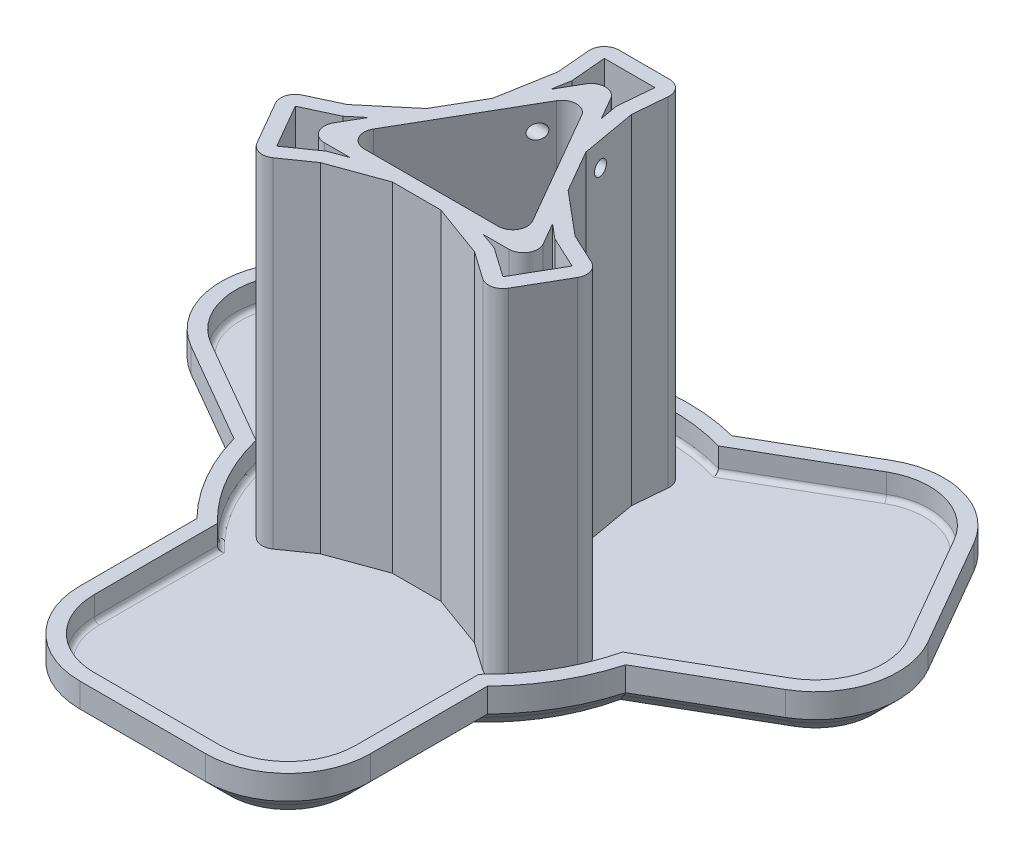
from build123d import *

# Parameters (mm, degrees)
SKETCH_1_R               = 40
EXTRUDE_1_DEPTH          = 5
EXTRUDE_2_DEPTH          = 70
FILLET_1_R               = 15
FILLET_2_R               = 3
SKETCH_6_R               = 3.5
SKETCH_6_R_2             = 1.5
CUT_EXTRUDE_1_DEPTH      = 5
FILLET_3_R               = 3
CUT_EXTRUDE_2_DEPTH      = 10
CUT_EXTRUDE_2_DEPTH_BACK = 10
SKETCH_7_R               = 1.5
CHAMFER_1_SIZE           = 2
EXTRUDE_3_DEPTH          = 5
CHAMFER_2_SIZE           = 2
CHAMFER_3_SIZE           = 3
FILLET_4_R               = 1


with BuildPart() as part:
    # 草图1 → 凸台-拉伸1 (new body)
    with BuildSketch(Plane(origin=(0, 0, 0), x_dir=(1, 0, 0), z_dir=(0, 1, 0))):
        Circle(SKETCH_1_R)
        with BuildLine():
            Line((-73.379649905, 10.034145551), (-38.738633754, -9.965854449))
            ThreePointArc((-38.738633754, -9.965854449), (-34.641016151, 20), (-10.738633754, 38.531568163))
            Line((-10.738633754, 38.531568163), (-45.379649905, 58.531568163))
            Line((-45.379649905, 58.531568163), (-73.379649905, 10.034145551))
        make_face()
        with BuildLine():
            ThreePointArc((40, 0), (39.683405538, -5.02268105), (38.738633754, -9.965854449))
            Line((38.738633754, -9.965854449), (73.379649905, 10.034145551))
            Line((73.379649905, 10.034145551), (45.379649905, 58.531568163))
            Line((45.379649905, 58.531568163), (10.738633754, 38.531568163))
            ThreePointArc((10.738633754, 38.531568163), (31.85549678, 24.191472153), (40, 0))
        make_face()
        with BuildLine():
            ThreePointArc((28, -28.565713714), (0, -40), (-28, -28.565713714))
            Line((-28, -28.565713714), (-28, -68.565713714))
            Line((-28, -68.565713714), (28, -68.565713714))
            Line((28, -68.565713714), (28, -28.565713714))
        make_face()
    extrude(amount=EXTRUDE_1_DEPTH)

    # 草图3 → 凸台-拉伸2 (add)
    with BuildSketch(Plane(origin=(0, 5, 0), x_dir=(1, 0, 0), z_dir=(0, 1, 0))):
        Polygon((5, -14), (13.7714132, -14), (5.528980942, -11), (-5.528980942, -11), (-13.7714132, -14), (-5, -14), align=None)
        Polygon((23.529502777, -4.802432686), (14.624355653, 2.669872981), (19.010062253, -4.926393678), (21.90369494, -7.354439798), (28.593799362, -10.474086724), (23.367724865, -19.525913276), (17.320979166, -15.291936356), (13.7714132, -14), (5, -14), (15.923780094, -17.9759308), (24.328838325, -23.861215932), (32.828838325, -9.138784068), align=None)
        Polygon((-19.010062253, -4.926393678), (-14.624355653, 2.669872981), (-23.529502777, -4.802432686), (-32.828838325, -9.138784068), (-24.328838325, -23.861215932), (-15.923780094, -17.9759308), (-5, -14), (-13.7714132, -14), (-17.320979166, -15.291936356), (-23.367724865, -19.525913276), (-28.593799362, -10.474086724), (-21.90369494, -7.354439798), align=None)
        Polygon((-6.761788971, 10.288237953), (-5.238649053, 18.926393678), (-9.624355653, 11.330127019), (-14.624355653, 2.669872981), (-19.010062253, -4.926393678), (-12.290769913, 0.711762047), align=None)
        Polygon((5.238649053, 18.926393678), (9.624355653, 11.330127019), (7.605722682, 22.778363486), (8.5, 33), (-8.5, 33), (-7.605722682, 22.778363486), (-9.624355653, 11.330127019), (-5.238649053, 18.926393678), (-4.582715774, 22.646376154), (-5.226074497, 30), (5.226074497, 30), (4.582715774, 22.646376154), align=None)
        Polygon((14.624355653, 2.669872981), (9.624355653, 11.330127019), (5.238649053, 18.926393678), (6.761788971, 10.288237953), (12.290769913, 0.711762047), (19.010062253, -4.926393678), align=None)
        Polygon((24.248711306, -14), (19.010062253, -4.926393678), (12.290769913, 0.711762047), (19.052558883, -11), (5.528980942, -11), (13.7714132, -14), align=None)
        Polygon((-19.052558883, -11), (-12.290769913, 0.711762047), (-19.010062253, -4.926393678), (-24.248711306, -14), (-13.7714132, -14), (-5.528980942, -11), align=None)
        Polygon((6.761788971, 10.288237953), (5.238649053, 18.926393678), (0, 28), (-5.238649053, 18.926393678), (-6.761788971, 10.288237953), (0, 22), align=None)
    extrude(amount=EXTRUDE_2_DEPTH)

    # 圆角1
    fillet_1_edges = [part.edges().sort_by_distance(p)[0] for p in [
        (28, 2.5, 68.565713714),
        (-28, 2.5, 68.565713714),
        (-73.379649905, 2.5, -10.034145551),
        (-45.379649905, 2.5, -58.531568163),
        (45.379649905, 2.5, -58.531568163),
        (73.379649905, 2.5, -10.034145551),
    ]]
    fillet(fillet_1_edges, radius=FILLET_1_R)

    # 圆角2
    fillet_2_edges = [part.edges().sort_by_distance(p)[0] for p in [
        (24.248711306, 40, 14),
        (-24.248711306, 40, 14),
        (-19.052558883, 40, 11),
        (0, 40, -22),
        (0, 40, -28),
        (19.052558883, 40, 11),
    ]]
    fillet(fillet_2_edges, radius=FILLET_2_R)

    # 草图6 → 切除-拉伸1 (cut)
    with BuildSketch(Plane.XZ):
        with Locations(Location((0, 0, 0), (0, 0, 270))):
            Circle(SKETCH_6_R)
        with Locations(Location((0, 7, 0), (0, 0, 270))):
            Circle(SKETCH_6_R_2)
        with Locations(Location((7, 0, 0), (0, 0, 270))):
            Circle(SKETCH_6_R_2)
        with Locations(Location((-7, 0, 0), (0, 0, 90))):
            Circle(SKETCH_6_R_2)
        with Locations(Location((0, -7, 0), (0, 0, 90))):
            Circle(SKETCH_6_R_2)
    extrude(amount=-CUT_EXTRUDE_1_DEPTH, mode=Mode.SUBTRACT)

    # 圆角3
    fillet_3_edges = [part.edges().sort_by_distance(p)[0] for p in [
        (-32.828838325, 40, 9.138784068),
        (-24.328838325, 40, 23.861215932),
        (24.328838325, 40, 23.861215932),
        (32.828838325, 40, 9.138784068),
        (8.5, 40, -33),
        (-8.5, 40, -33),
    ]]
    fillet(fillet_3_edges, radius=FILLET_3_R)

    # 草图7 → 切除-拉伸2 (cut, two sides: drawn at the far end of the back side and taken through both)
    with BuildSketch(Plane(origin=(0, 0, 0), x_dir=(0, 0, -1), z_dir=(1, 0, 0)).offset(-CUT_EXTRUDE_2_DEPTH_BACK)):
        with Locations((15, 70)):
            Circle(SKETCH_7_R)
    extrude(amount=CUT_EXTRUDE_2_DEPTH + CUT_EXTRUDE_2_DEPTH_BACK, mode=Mode.SUBTRACT)

    # 倒角1
    chamfer_1_edges = [part.edges().sort_by_distance(p)[0] for p in [
        (9.526279442, 5, -5.5),
        (-9.526279442, 5, -5.5),
        (0, 5, 11),
        (-16.454482672, 5, 9.5),
        (16.454482672, 5, 9.5),
        (0, 5, -19),
    ]]
    chamfer(chamfer_1_edges, length=CHAMFER_1_SIZE)

    # 草图8 → 凸台-拉伸3 (add)
    # profile 1 of 2: a face of its own
    with BuildSketch(Plane(origin=(0, 5, 0), x_dir=(1, 0, 0), z_dir=(0, 1, 0))):
        with BuildLine():
            Line((-54.611700713, 46.541187106), (-67.611700713, 24.024526608))
            ThreePointArc((-67.611700713, 24.024526608), (-69.310007895, 11.124602841), (-61.389268848, 0.802094744))
            Line((-61.389268848, 0.802094744), (-40.455844123, -11.283823657))
            ThreePointArc((-40.455844123, -11.283823657), (-36.373066959, -21), (-30, -29.393876913))
            Line((-30, -29.393876913), (-30, -53.565713714))
            ThreePointArc((-30, -53.565713714), (-25.02081528, -65.586528994), (-13, -70.565713714))
            Line((-13, -70.565713714), (13, -70.565713714))
            ThreePointArc((13, -70.565713714), (25.02081528, -65.586528994), (30, -53.565713714))
            Line((30, -53.565713714), (30, -29.393876913))
            ThreePointArc((30, -29.393876913), (36.373066959, -21), (40.455844123, -11.283823657))
            Line((40.455844123, -11.283823657), (61.389268848, 0.802094744))
            ThreePointArc((61.389268848, 0.802094744), (69.310007895, 11.124602841), (67.611700713, 24.024526608))
            Line((67.611700713, 24.024526608), (54.611700713, 46.541187106))
            ThreePointArc((54.611700713, 46.541187106), (44.289192615, 54.461926153), (31.389268848, 52.763618971))
            Line((31.389268848, 52.763618971), (10.455844123, 40.67770057))
            ThreePointArc((10.455844123, 40.67770057), (0, 42), (-10.455844123, 40.67770057))
            Line((-10.455844123, 40.67770057), (-31.389268848, 52.763618971))
            ThreePointArc((-31.389268848, 52.763618971), (-44.289192615, 54.461926153), (-54.611700713, 46.541187106))
        make_face()
        with BuildLine():
            Line((-13, -68.565713714), (13, -68.565713714))
            ThreePointArc((13, -68.565713714), (23.606601718, -64.172315432), (28, -53.565713714))
            Line((28, -53.565713714), (28, -28.565713714))
            ThreePointArc((28, -28.565713714), (34.641016151, -20), (38.738633754, -9.965854449))
            Line((38.738633754, -9.965854449), (60.389268848, 2.534145551))
            ThreePointArc((60.389268848, 2.534145551), (67.378156243, 11.642240931), (65.879649905, 23.024526608))
            Line((65.879649905, 23.024526608), (52.879649905, 45.541187106))
            ThreePointArc((52.879649905, 45.541187106), (43.771554525, 52.530074501), (32.389268848, 51.031568163))
            Line((32.389268848, 51.031568163), (10.738633754, 38.531568163))
            ThreePointArc((10.738633754, 38.531568163), (0, 40), (-10.738633754, 38.531568163))
            Line((-10.738633754, 38.531568163), (-32.389268848, 51.031568163))
            ThreePointArc((-32.389268848, 51.031568163), (-43.771554525, 52.530074501), (-52.879649905, 45.541187106))
            Line((-52.879649905, 45.541187106), (-65.879649905, 23.024526608))
            ThreePointArc((-65.879649905, 23.024526608), (-67.378156243, 11.642240931), (-60.389268848, 2.534145551))
            Line((-60.389268848, 2.534145551), (-38.738633754, -9.965854449))
            ThreePointArc((-38.738633754, -9.965854449), (-34.641016151, -20), (-28, -28.565713714))
            Line((-28, -28.565713714), (-28, -53.565713714))
            ThreePointArc((-28, -53.565713714), (-23.606601718, -64.172315432), (-13, -68.565713714))
        make_face(mode=Mode.SUBTRACT)
    # profile 2 of 2: a face of its own
    with BuildSketch(Plane(origin=(0, 5, 0), x_dir=(1, 0, 0), z_dir=(0, 1, 0))):
        with BuildLine():
            ThreePointArc((-28, -53.565713714), (-23.606601718, -64.172315432), (-13, -68.565713714))
            Line((-13, -68.565713714), (13, -68.565713714))
            ThreePointArc((13, -68.565713714), (23.606601718, -64.172315432), (28, -53.565713714))
            Line((28, -53.565713714), (28, -28.565713714))
            ThreePointArc((28, -28.565713714), (34.641016151, -20), (38.738633754, -9.965854449))
            Line((38.738633754, -9.965854449), (60.389268848, 2.534145551))
            ThreePointArc((60.389268848, 2.534145551), (67.378156243, 11.642240931), (65.879649905, 23.024526608))
            Line((65.879649905, 23.024526608), (52.879649905, 45.541187106))
            ThreePointArc((52.879649905, 45.541187106), (43.771554525, 52.530074501), (32.389268848, 51.031568163))
            Line((32.389268848, 51.031568163), (10.738633754, 38.531568163))
            ThreePointArc((10.738633754, 38.531568163), (0, 40), (-10.738633754, 38.531568163))
            Line((-10.738633754, 38.531568163), (-32.389268848, 51.031568163))
            ThreePointArc((-32.389268848, 51.031568163), (-43.771554525, 52.530074501), (-52.879649905, 45.541187106))
            Line((-52.879649905, 45.541187106), (-65.879649905, 23.024526608))
            ThreePointArc((-65.879649905, 23.024526608), (-67.378156243, 11.642240931), (-60.389268848, 2.534145551))
            Line((-60.389268848, 2.534145551), (-38.738633754, -9.965854449))
            ThreePointArc((-38.738633754, -9.965854449), (-34.641016151, -20), (-28, -28.565713714))
            Line((-28, -28.565713714), (-28, -53.565713714))
        make_face()
        with BuildLine():
            ThreePointArc((-37.872115214, -9.311438623), (-33.774990748, -19.5), (-27, -28.142494559))
            Line((-27, -28.142494559), (-27, -53.565713714))
            ThreePointArc((-27, -53.565713714), (-22.899494937, -63.465208651), (-13, -67.565713714))
            Line((-13, -67.565713714), (13, -67.565713714))
            ThreePointArc((13, -67.565713714), (22.899494937, -63.465208651), (27, -53.565713714))
            Line((27, -53.565713714), (27, -28.142494559))
            ThreePointArc((27, -28.142494559), (33.774990748, -19.5), (37.872115214, -9.311438623))
            Line((37.872115214, -9.311438623), (59.889268848, 3.400170955))
            ThreePointArc((59.889268848, 3.400170955), (66.412230416, 11.901059976), (65.013624501, 22.524526608))
            Line((65.013624501, 22.524526608), (52.013624501, 45.041187106))
            ThreePointArc((52.013624501, 45.041187106), (43.51273548, 51.564148674), (32.889268848, 50.165542759))
            Line((32.889268848, 50.165542759), (10.872115214, 37.453933182))
            ThreePointArc((10.872115214, 37.453933182), (0, 39), (-10.872115214, 37.453933182))
            Line((-10.872115214, 37.453933182), (-32.889268848, 50.165542759))
            ThreePointArc((-32.889268848, 50.165542759), (-43.51273548, 51.564148674), (-52.013624501, 45.041187106))
            Line((-52.013624501, 45.041187106), (-65.013624501, 22.524526608))
            ThreePointArc((-65.013624501, 22.524526608), (-66.412230416, 11.901059976), (-59.889268848, 3.400170955))
            Line((-59.889268848, 3.400170955), (-37.872115214, -9.311438623))
        make_face(mode=Mode.SUBTRACT)
    extrude(amount=EXTRUDE_3_DEPTH)

    # 倒角2
    chamfer_2_edges = [part.edges().sort_by_distance(p)[0] for p in [
        (49.563951301, 5, 3.715854449),
        (0, 5, 68.565713714),
        (59.379649905, 5, -34.282856857),
        (-59.379649905, 5, -34.282856857),
        (43.771554525, 5, -52.530074501),
        (67.378156243, 5, -11.642240931),
        (-43.771554525, 5, -52.530074501),
        (-67.378156243, 5, -11.642240931),
        (-23.606601718, 5, 64.172315432),
        (23.606601718, 5, 64.172315432),
        (21.563951301, 5, -44.781568163),
        (0, 5, -40),
        (-21.563951301, 5, -44.781568163),
        (-49.563951301, 5, 3.715854449),
        (-34.641016151, 5, 20),
        (-28, 5, 41.065713714),
        (34.641016151, 5, 20),
        (28, 5, 41.065713714),
    ]]
    chamfer(chamfer_2_edges, length=CHAMFER_2_SIZE - 0.0001)  # a hair under: the kernel refuses the full size

    # 倒角3
    chamfer_3_edges = [part.edges().sort_by_distance(p)[0] for p in [
        (-34.641016151, 0, 20),
        (-28, 0, 41.065713714),
        (-23.606601718, 0, 64.172315432),
        (0, 0, 68.565713714),
        (23.606601718, 0, 64.172315432),
        (34.641016151, 0, 20),
        (28, 0, 41.065713714),
        (49.563951301, 0, 3.715854449),
        (67.378156243, 0, -11.642240931),
        (59.379649905, 0, -34.282856857),
        (43.771554525, 0, -52.530074501),
        (21.563951301, 0, -44.781568163),
        (0, 0, -40),
        (-49.563951301, 0, 3.715854449),
        (-21.563951301, 0, -44.781568163),
        (-67.378156243, 0, -11.642240931),
        (-43.771554525, 0, -52.530074501),
        (-59.379649905, 0, -34.282856857),
    ]]
    chamfer(chamfer_3_edges, length=CHAMFER_3_SIZE)

    # 圆角4
    fillet_4_edges = [part.edges().sort_by_distance(p)[0] for p in [
        (-33.774990748, 5, 19.5),
        (-27, 5, 40.854104137),
        (-22.899494937, 5, 63.465208651),
        (0, 5, 67.565713714),
        (22.899494937, 5, 63.465208651),
        (27, 5, 40.854104137),
        (33.774990748, 5, 19.5),
        (48.880692031, 5, 2.955633834),
        (66.412230416, 5, -11.901059976),
        (58.513624501, 5, -33.782856857),
        (43.51273548, 5, -51.564148674),
        (21.880692031, 5, -43.80973797),
        (0, 5, -39),
        (-21.880692031, 5, -43.80973797),
        (-43.51273548, 5, -51.564148674),
        (-58.513624501, 5, -33.782856857),
        (-66.412230416, 5, -11.901059976),
        (-48.880692031, 5, 2.955633834),
    ]]
    fillet(fillet_4_edges, radius=FILLET_4_R)


solid = part.part
